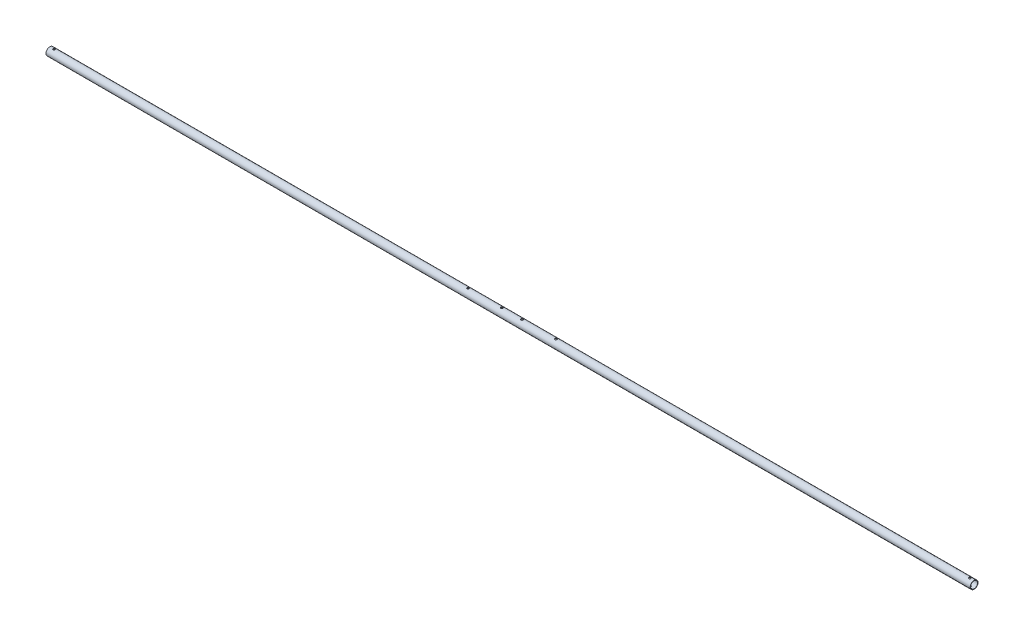
from build123d import *

# Parameters (mm, degrees)
SKETCH3_R               = 11.7094
SKETCH3_R_2             = 10.4648
BOSS_EXTRUDE1_DEPTH     = 2781.3
CUT_EXTRUDE1_DEPTH      = 2782.349296672
CUT_EXTRUDE1_DEPTH_BACK = 2782.349296672
SKETCH4_R               = 3.175
CUT_EXTRUDE2_DEPTH      = 2782.349296773
CUT_EXTRUDE2_DEPTH_BACK = 2782.349296773
SKETCH5_R               = 3.175


with BuildPart() as part:
    # Sketch3 → Boss-Extrude1 (new body)
    with BuildSketch(Plane(origin=(0, 0, 0), x_dir=(0, 0, -1), z_dir=(1, 0, 0))):
        Circle(SKETCH3_R)
        Circle(SKETCH3_R_2, mode=Mode.SUBTRACT)
    extrude(amount=BOSS_EXTRUDE1_DEPTH)

    # Sketch4 → Cut-Extrude1 (cut, two sides: drawn at the far end of the back side and taken through both)
    with BuildSketch(Plane(origin=(0, 0, 0), x_dir=(1, 0, 0), z_dir=(0, 1, 0)).offset(-CUT_EXTRUDE1_DEPTH_BACK)):
        with Locations((1360.17, 0)):
            Circle(SKETCH4_R)
        with Locations((1421.13, 0)):
            Circle(SKETCH4_R)
        with Locations((1522.8316, 0)):
            Circle(SKETCH4_R)
        with Locations((1258.4684, 0)):
            Circle(SKETCH4_R)
    extrude(amount=CUT_EXTRUDE1_DEPTH + CUT_EXTRUDE1_DEPTH_BACK, mode=Mode.SUBTRACT)

    # Sketch5 → Cut-Extrude2 (cut, two sides: drawn at the far end of the back side and taken through both)
    with BuildSketch(Plane(origin=(0, 0, 0), x_dir=(1, 0, 0), z_dir=(0, 1, 0)).offset(-CUT_EXTRUDE2_DEPTH_BACK)):
        with Locations((12.7, 0)):
            Circle(SKETCH5_R)
        with Locations((2768.6, 0)):
            Circle(SKETCH5_R)
    extrude(amount=CUT_EXTRUDE2_DEPTH + CUT_EXTRUDE2_DEPTH_BACK, mode=Mode.SUBTRACT)


solid = part.part
